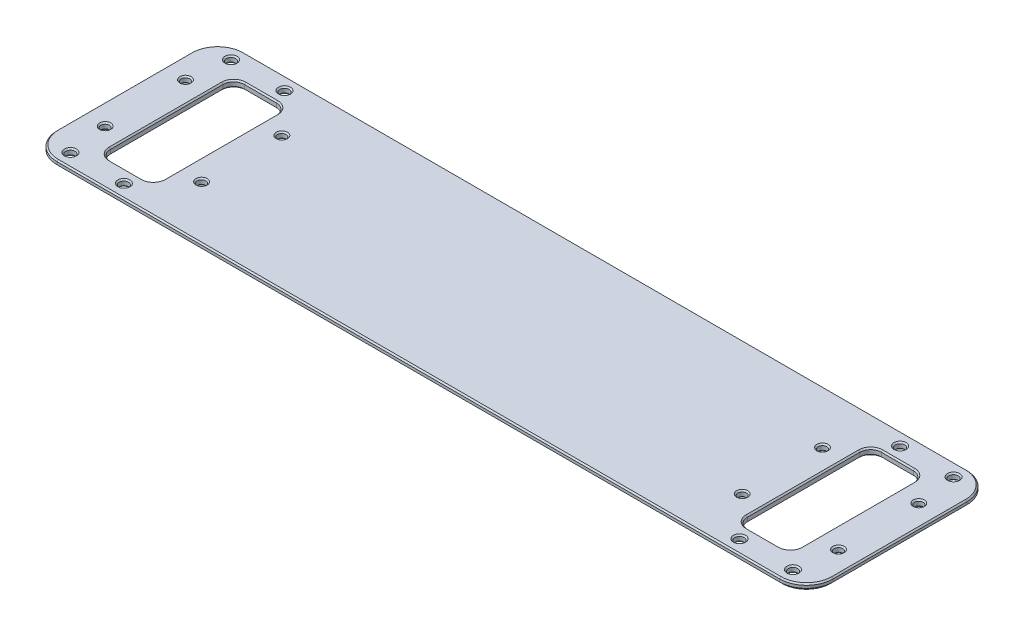
from build123d import *

# Parameters (mm, degrees)
SKETCH1_W           = 368.3
SKETCH1_H           = 88.9
SKETCH1_R           = 2.032
SKETCH1_R_2         = 2.2225
SKETCH1_W_2         = 25.4
SKETCH1_H_2         = 63.5
BOSS_EXTRUDE1_DEPTH = 3.175
FILLET1_R           = 5.08
FILLET2_R           = 5.08
FILLET3_R           = 12.7
CHAMFER3_SIZE       = 0.635
CHAMFER4_SIZE       = 1.27
CHAMFER5_SIZE       = 0.635
CHAMFER6_SIZE       = 0.635
CHAMFER7_SIZE       = 0.635


with BuildPart() as part:
    # Sketch1 → Boss-Extrude1 (new body)
    with BuildSketch(Plane(origin=(0, 0, 0), x_dir=(1, 0, 0), z_dir=(0, 1, 0))):
        Rectangle(SKETCH1_W, SKETCH1_H)
        with Locations((-128.27, 19.05)):
            Circle(SKETCH1_R, mode=Mode.SUBTRACT)
        with Locations((-128.27, -19.05)):
            Circle(SKETCH1_R, mode=Mode.SUBTRACT)
        with Locations((-173.99, 19.05)):
            Circle(SKETCH1_R, mode=Mode.SUBTRACT)
        with Locations((-173.99, -19.05)):
            Circle(SKETCH1_R, mode=Mode.SUBTRACT)
        with Locations((173.99, 19.05)):
            Circle(SKETCH1_R, mode=Mode.SUBTRACT)
        with Locations((128.27, 19.05)):
            Circle(SKETCH1_R, mode=Mode.SUBTRACT)
        with Locations((128.27, -19.05)):
            Circle(SKETCH1_R, mode=Mode.SUBTRACT)
        with Locations((173.99, -19.05)):
            Circle(SKETCH1_R, mode=Mode.SUBTRACT)
        with Locations((171.45, -38.1)):
            Circle(SKETCH1_R_2, mode=Mode.SUBTRACT)
        with Locations((146.05, -38.1)):
            Circle(SKETCH1_R_2, mode=Mode.SUBTRACT)
        with Locations((171.45, 38.1)):
            Circle(SKETCH1_R_2, mode=Mode.SUBTRACT)
        with Locations((146.05, 38.1)):
            Circle(SKETCH1_R_2, mode=Mode.SUBTRACT)
        with Locations((-146.05, -38.1)):
            Circle(SKETCH1_R_2, mode=Mode.SUBTRACT)
        with Locations((-171.45, -38.1)):
            Circle(SKETCH1_R_2, mode=Mode.SUBTRACT)
        with Locations((-146.05, 38.1)):
            Circle(SKETCH1_R_2, mode=Mode.SUBTRACT)
        with Locations((-171.45, 38.1)):
            Circle(SKETCH1_R_2, mode=Mode.SUBTRACT)
        with Locations((-151.13, 0)):
            Rectangle(SKETCH1_W_2, SKETCH1_H_2, mode=Mode.SUBTRACT)
        with Locations((151.13, 0)):
            Rectangle(SKETCH1_W_2, SKETCH1_H_2, mode=Mode.SUBTRACT)
    extrude(amount=BOSS_EXTRUDE1_DEPTH)

    # Fillet1
    fillet1_edges = [part.edges().sort_by_distance(p)[0] for p in [
        (-138.43, 1.5875, 31.75),
        (-163.83, 1.5875, 31.75),
        (-163.83, 1.5875, -31.75),
        (-138.43, 1.5875, -31.75),
    ]]
    fillet(fillet1_edges, radius=FILLET1_R)

    # Fillet2
    fillet2_edges = [part.edges().sort_by_distance(p)[0] for p in [
        (163.83, 1.5875, 31.75),
        (138.43, 1.5875, 31.75),
        (138.43, 1.5875, -31.75),
        (163.83, 1.5875, -31.75),
    ]]
    fillet(fillet2_edges, radius=FILLET2_R)

    # Fillet3
    fillet3_edges = [part.edges().sort_by_distance(p)[0] for p in [
        (184.15, 1.5875, 44.45),
        (184.15, 1.5875, -44.45),
        (-184.15, 1.5875, 44.45),
        (-184.15, 1.5875, -44.45),
    ]]
    fillet(fillet3_edges, radius=FILLET3_R)

    # Chamfer3
    chamfer3_edges = [part.edges().sort_by_distance(p)[0] for p in [
        (162.342102448, 3.175, -30.262102448),
        (151.13, 3.175, -31.75),
        (139.917897552, 3.175, -30.262102448),
        (163.83, 3.175, 0),
        (162.342102448, 3.175, 30.262102448),
        (151.13, 3.175, 31.75),
        (139.917897552, 3.175, 30.262102448),
        (138.43, 3.175, 0),
        (139.917897552, 0, -30.262102448),
        (151.13, 0, -31.75),
        (162.342102448, 0, -30.262102448),
        (163.83, 0, 0),
        (162.342102448, 0, 30.262102448),
        (151.13, 0, 31.75),
        (139.917897552, 0, 30.262102448),
        (138.43, 0, 0),
        (-139.917897552, 3.175, 30.262102448),
        (-151.13, 3.175, 31.75),
        (-138.43, 3.175, 0),
        (-139.917897552, 3.175, -30.262102448),
        (-151.13, 3.175, -31.75),
        (-162.342102448, 3.175, 30.262102448),
        (-162.342102448, 3.175, -30.262102448),
        (-163.83, 3.175, 0),
        (-139.917897552, 0, 30.262102448),
        (-151.13, 0, 31.75),
        (-138.43, 0, 0),
        (-139.917897552, 0, -30.262102448),
        (-151.13, 0, -31.75),
        (-162.342102448, 0, 30.262102448),
        (-163.83, 0, 0),
        (-162.342102448, 0, -30.262102448),
    ]]
    chamfer(chamfer3_edges, length=CHAMFER3_SIZE)

    # Chamfer4
    chamfer4_edges = [part.edges().sort_by_distance(p)[0] for p in [
        (180.430256121, 0, -40.730256121),
        (0, 0, -44.45),
        (-180.430256121, 0, -40.730256121),
        (-184.15, 0, 0),
        (-180.430256121, 0, 40.730256121),
        (0, 0, 44.45),
        (180.430256121, 0, 40.730256121),
        (184.15, 0, 0),
    ]]
    chamfer(chamfer4_edges, length=CHAMFER4_SIZE)

    # Chamfer5
    chamfer5_edges = [part.edges().sort_by_distance(p)[0] for p in [
        (-176.022, 0, 19.05),
        (-176.022, 0, -19.05),
        (-130.302, 0, -19.05),
        (-130.302, 0, 19.05),
        (171.958, 0, 19.05),
        (171.958, 0, -19.05),
        (126.238, 0, 19.05),
        (126.238, 0, -19.05),
        (-173.6725, 0, -38.1),
        (-148.2725, 0, -38.1),
        (-148.2725, 0, 38.1),
        (-173.6725, 0, 38.1),
        (143.8275, 0, 38.1),
        (169.2275, 0, 38.1),
        (143.8275, 0, -38.1),
        (169.2275, 0, -38.1),
    ]]
    chamfer(chamfer5_edges, length=CHAMFER5_SIZE)

    # Chamfer6
    chamfer6_edges = [part.edges().sort_by_distance(p)[0] for p in [
        (180.430256121, 3.175, 40.730256121),
        (184.15, 3.175, 0),
        (180.430256121, 3.175, -40.730256121),
        (0, 3.175, 44.45),
        (-180.430256121, 3.175, 40.730256121),
        (-184.15, 3.175, 0),
        (0, 3.175, -44.45),
        (-180.430256121, 3.175, -40.730256121),
    ]]
    chamfer(chamfer6_edges, length=CHAMFER6_SIZE)

    # Chamfer7
    chamfer7_edges = [part.edges().sort_by_distance(p)[0] for p in [
        (-176.022, 3.175, 19.05),
        (-176.022, 3.175, -19.05),
        (-130.302, 3.175, -19.05),
        (-130.302, 3.175, 19.05),
        (126.238, 3.175, 19.05),
        (126.238, 3.175, -19.05),
        (171.958, 3.175, -19.05),
        (171.958, 3.175, 19.05),
        (143.8275, 3.175, -38.1),
        (169.2275, 3.175, -38.1),
        (143.8275, 3.175, 38.1),
        (169.2275, 3.175, 38.1),
        (-148.2725, 3.175, -38.1),
        (-173.6725, 3.175, -38.1),
        (-173.6725, 3.175, 38.1),
        (-148.2725, 3.175, 38.1),
    ]]
    chamfer(chamfer7_edges, length=CHAMFER7_SIZE)


solid = part.part
